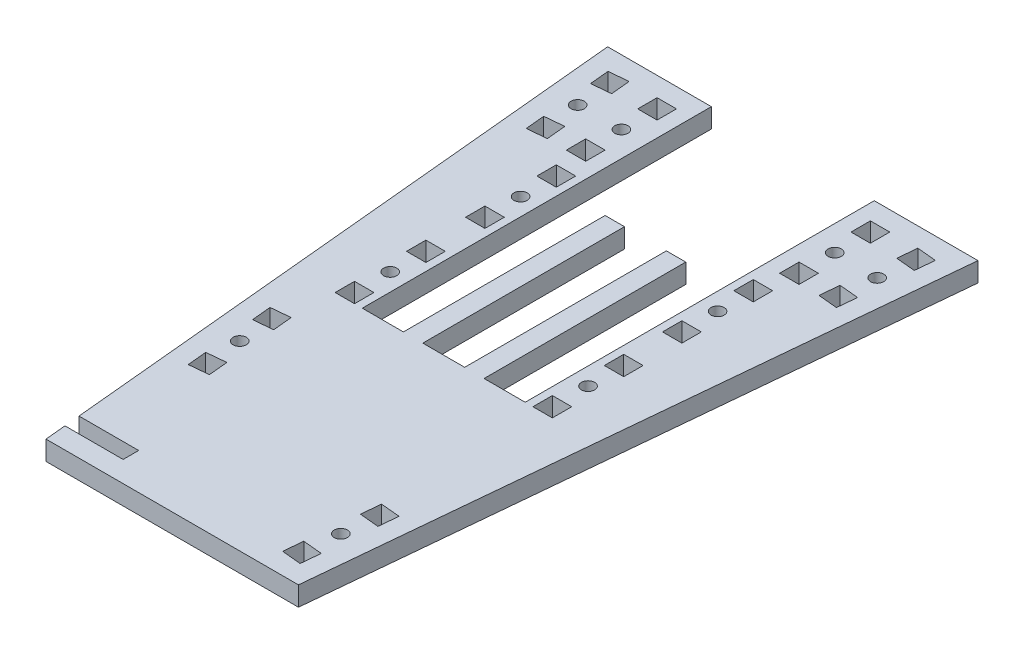
from build123d import *

# Parameters (mm, degrees)
SKETCH1_R           = 2.159
SKETCH1_W           = 6.35
SKETCH1_H           = 6.35
BOSS_EXTRUDE1_DEPTH = 6.35


with BuildPart() as part:
    # Sketch1 → Boss-Extrude1 (new body)
    with BuildSketch(Plane(origin=(0, 0, 0), x_dir=(1, 0, 0), z_dir=(0, 1, 0))):
        Polygon((-26.67, 114.3), (-47.875911854, 114.3), (-60.633073629, 114.3), (-42.466090347, -76.962), (-22.93356755, -76.962), (-22.93356755, -82.042), (-41.98356755, -82.042), (-41.332161775, -88.9), (-28.575, -88.9), (0, -88.9), (28.575, -88.9), (41.332161775, -88.9), (60.633073629, 114.3), (47.875911854, 114.3), (26.67, 114.3), (26.67, 0), (13.208, 0), (13.208, 66.04), (6.858, 66.04), (6.858, 0), (-6.858, 0), (-6.858, 66.04), (-13.208, 66.04), (-13.208, 0), (-26.67, 0), align=None)
        Polygon((-39.17295277, -44.478452823), (-39.773403679, -38.156905647), (-33.451856503, -37.556454737), (-32.851405593, -43.878001914), align=None, mode=Mode.SUBTRACT)
        with Locations((-37.41723431, -29.385806976)):
            Circle(SKETCH1_R, mode=Mode.SUBTRACT)
        Polygon((-35.66151585, -14.293161128), (-35.061064941, -20.614708304), (-41.382612117, -21.215159214), (-41.983063027, -14.893612037), align=None, mode=Mode.SUBTRACT)
        with Locations((-32.385, 3.175)):
            Rectangle(SKETCH1_W, SKETCH1_H, mode=Mode.SUBTRACT)
        Polygon((29.83293553, -75.656454737), (36.154482707, -76.256905647), (35.554031797, -82.578452823), (29.232484621, -81.978001914), align=None, mode=Mode.SUBTRACT)
        with Locations((33.798313337, -67.485806976)):
            Circle(SKETCH1_R, mode=Mode.SUBTRACT)
        Polygon((37.763691145, -59.315159214), (31.442143968, -58.714708304), (32.042594878, -52.393161128), (38.364142054, -52.993612037), align=None, mode=Mode.SUBTRACT)
        with Locations((32.385, 3.175)):
            Rectangle(SKETCH1_W, SKETCH1_H, mode=Mode.SUBTRACT)
        with Locations((-32.385, 14.859)):
            Circle(SKETCH1_R, mode=Mode.SUBTRACT)
        with Locations((-32.385, 26.543)):
            Rectangle(SKETCH1_W, SKETCH1_H, mode=Mode.SUBTRACT)
        with Locations((-32.385, 45.868088631)):
            Rectangle(SKETCH1_W, SKETCH1_H, mode=Mode.SUBTRACT)
        with Locations((-32.385, 57.552088631)):
            Circle(SKETCH1_R, mode=Mode.SUBTRACT)
        Polygon((-50.786897864, 77.793161128), (-51.387348774, 84.114708304), (-45.065801597, 84.715159214), (-44.465350687, 78.393612037), align=None, mode=Mode.SUBTRACT)
        with Locations((-32.385, 69.236088631)):
            Rectangle(SKETCH1_W, SKETCH1_H, mode=Mode.SUBTRACT)
        with Locations((-34.925, 81.407)):
            Rectangle(SKETCH1_W, SKETCH1_H, mode=Mode.SUBTRACT)
        with Locations((-49.031179404, 92.885806976)):
            Circle(SKETCH1_R, mode=Mode.SUBTRACT)
        Polygon((-47.275460944, 107.978452823), (-46.675010035, 101.656905647), (-52.996557211, 101.056454737), (-53.597008121, 107.378001914), align=None, mode=Mode.SUBTRACT)
        with Locations((-34.925, 93.091)):
            Circle(SKETCH1_R, mode=Mode.SUBTRACT)
        with Locations((-34.925, 104.775)):
            Rectangle(SKETCH1_W, SKETCH1_H, mode=Mode.SUBTRACT)
        with Locations((32.385, 14.859)):
            Circle(SKETCH1_R, mode=Mode.SUBTRACT)
        with Locations((32.385, 26.543)):
            Rectangle(SKETCH1_W, SKETCH1_H, mode=Mode.SUBTRACT)
        with Locations((32.385, 45.593)):
            Rectangle(SKETCH1_W, SKETCH1_H, mode=Mode.SUBTRACT)
        with Locations((32.385, 57.277)):
            Circle(SKETCH1_R, mode=Mode.SUBTRACT)
        with Locations((32.385, 68.961)):
            Rectangle(SKETCH1_W, SKETCH1_H, mode=Mode.SUBTRACT)
        with Locations((34.925, 81.407)):
            Rectangle(SKETCH1_W, SKETCH1_H, mode=Mode.SUBTRACT)
        Polygon((45.065801597, 84.715159214), (51.387348774, 84.114708304), (50.786897864, 77.793161128), (44.465350687, 78.393612037), align=None, mode=Mode.SUBTRACT)
        with Locations((34.925, 93.091)):
            Circle(SKETCH1_R, mode=Mode.SUBTRACT)
        with Locations((34.925, 104.775)):
            Rectangle(SKETCH1_W, SKETCH1_H, mode=Mode.SUBTRACT)
        with Locations((49.031179404, 92.885806976)):
            Circle(SKETCH1_R, mode=Mode.SUBTRACT)
        Polygon((52.996557211, 101.056454737), (46.675010035, 101.656905647), (47.275460944, 107.978452823), (53.597008121, 107.378001914), align=None, mode=Mode.SUBTRACT)
    extrude(amount=BOSS_EXTRUDE1_DEPTH)


solid = part.part
